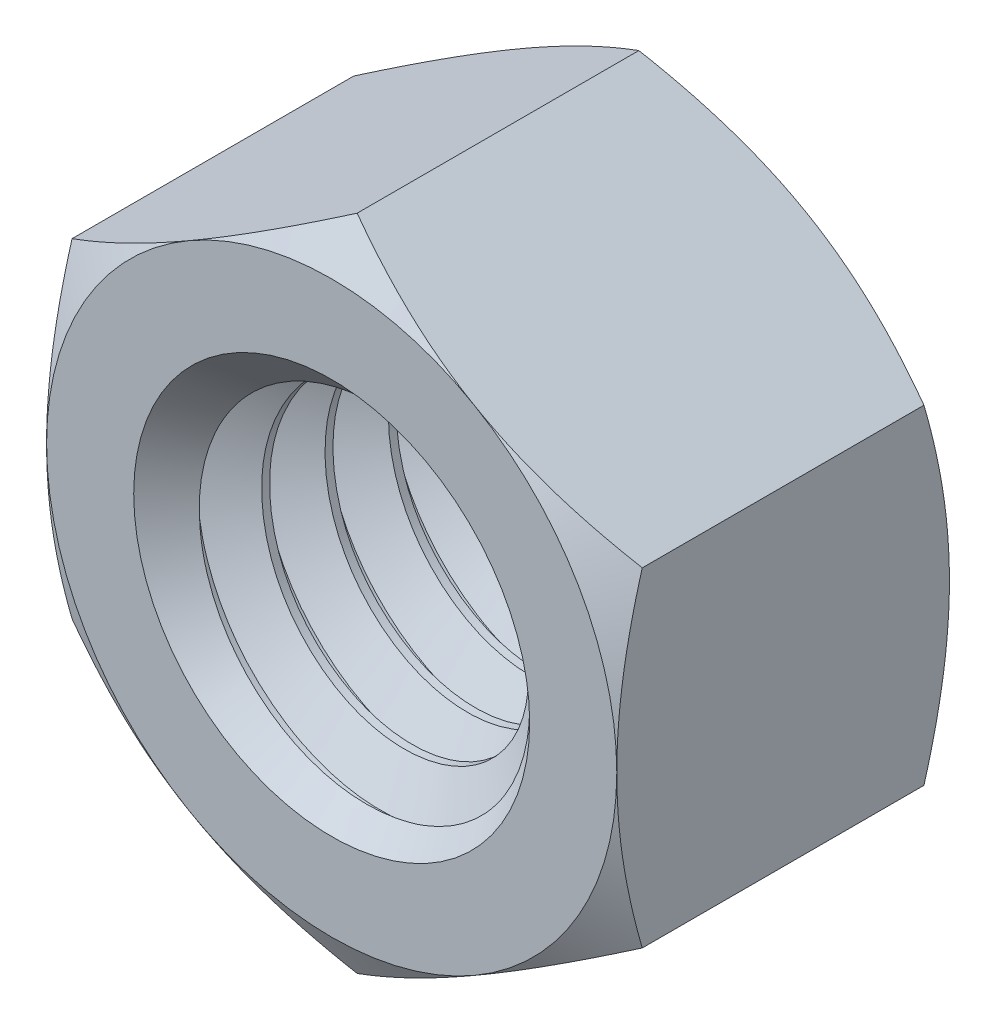
from build123d import *

# Parameters (mm, degrees)
SKETCH4_R                 = 4.7625
BOSS_EXTRUDE2_DEPTH       = 4.1671875
SKETCH5_OUTSIDE_W         = 71.99
SKETCH5_OUTSIDE_H         = 74.2
SKETCH5_OUTSIDE_R         = 7.14375
CUT_EXTRUDE1_DEPTH        = 14.730957339
CUT_EXTRUDE1_DRAFT        = -60
MIRROR1_COPY_1_SKETCH_W   = 71.99
MIRROR1_COPY_1_SKETCH_H   = 74.2
MIRROR1_COPY_1_SKETCH_R   = 7.14375
MIRROR1_COPY_1_DEPTH      = 14.730957339
MIRROR1_COPY_1_DRAFT      = -60
SKETCH6_R                 = 4.7625
BOSS_EXTRUDE3_DEPTH       = 8.334375
BODY_MOVE_COPY1_START     = -4.1671875
BODY_MOVE_COPY1_OUTLINE_R = 4.7625
BODY_MOVE_COPY1_DEPTH     = 8.334375
CUT_SWEEP1_PITCH          = 1.5875


# Read off the part's stored shape, not the designer's step: Body-Move/Copy1
with BuildPart() as part:
    # Sketch4 → Boss-Extrude2 (new, symmetric)
    with BuildSketch(Plane.XY):
        Polygon((0, 8.248891971), (-7.14375, 4.124445986), (-7.14375, -4.124445986), (0, -8.248891971), (7.14375, -4.124445986), (7.14375, 4.124445986), align=None)
        Circle(SKETCH4_R, mode=Mode.SUBTRACT)
    extrude(amount=BOSS_EXTRUDE2_DEPTH, both=True)


with BuildPart() as cut_extrude1_tool:
    # Sketch5 outside → Cut-Extrude1 (with draft: the straight prism first)
    with BuildSketch(Plane.XY.offset(4.1671875)):
        Rectangle(SKETCH5_OUTSIDE_W, SKETCH5_OUTSIDE_H)
        Circle(SKETCH5_OUTSIDE_R, mode=Mode.SUBTRACT)
    extrude(amount=-CUT_EXTRUDE1_DEPTH)
    # Cut-Extrude1: the draft: its side faces are tilted about the plane it starts from
    cut_extrude1_sides = [cut_extrude1_tool.faces().sort_by_distance(p)[0] for p in [
        (0, -37.1, -3.19829117),
        (35.995, 0, -3.19829117),
        (0, 37.1, -3.19829117),
        (-35.995, 0, -3.19829117),
        (-7.14375, 0, -3.19829117),
    ]]
    draft(cut_extrude1_sides, Plane.XY.offset(4.1671875), CUT_EXTRUDE1_DRAFT)


with BuildPart() as part_1:
    add(part.part)

    # Cut-Extrude1: cut by cut_extrude1_tool
    add(cut_extrude1_tool.part, mode=Mode.SUBTRACT)


with BuildPart() as mirror1_copy_1_tool:
    # Mirror1 copy 1 sketch → Mirror1 copy 1 (with draft: the straight prism first)
    with BuildSketch(Plane(origin=(0, 0, -4.1671875), x_dir=(1, 0, 0), z_dir=(0, 0, -1))):
        Rectangle(MIRROR1_COPY_1_SKETCH_W, MIRROR1_COPY_1_SKETCH_H)
        Circle(MIRROR1_COPY_1_SKETCH_R, mode=Mode.SUBTRACT)
    extrude(amount=-MIRROR1_COPY_1_DEPTH)
    # Mirror1 copy 1: the draft: its side faces are tilted about the plane it starts from
    mirror1_copy_1_sides = [mirror1_copy_1_tool.faces().sort_by_distance(p)[0] for p in [
        (0, -37.1, 3.19829117),
        (35.995, 0, 3.19829117),
        (0, 37.1, 3.19829117),
        (-35.995, 0, 3.19829117),
        (-7.14375, 0, 3.19829117),
    ]]
    draft(mirror1_copy_1_sides, Plane(origin=(0, 0, -4.1671875), x_dir=(1, 0, 0), z_dir=(0, 0, -1)), MIRROR1_COPY_1_DRAFT)


with BuildPart() as part_2:
    add(part_1.part)

    # Mirror1 copy 1: cut by mirror1_copy_1_tool
    add(mirror1_copy_1_tool.part, mode=Mode.SUBTRACT)


with BuildPart() as body_2:
    # Sketch6 → Boss-Extrude3 (new body)
    with BuildSketch(Plane.XY.offset(4.1671875)):
        Circle(SKETCH6_R)
    extrude(amount=-BOSS_EXTRUDE3_DEPTH)

    # Cut-Sweep1: the profile of Sketch8 screwed along a right-hand helix of 6.25 turns, 8 arcs to a turn; built about Z, then put on its axis
    cut_sweep1_z = Axis((0, 0, 0), (0, 0, 1))
    cut_sweep1_corners = [(4.934351916, 0, -1.48828125), (4.848425958, 0, 0.049609375), (3.731388504, 0, -0.5953125), (3.731388504, 0, -0.79375)]
    with BuildLine(mode=Mode.PRIVATE) as cut_sweep1_profile:
        Line(cut_sweep1_corners[0], cut_sweep1_corners[1])
        Line(cut_sweep1_corners[1], cut_sweep1_corners[2])
        Line(cut_sweep1_corners[2], cut_sweep1_corners[3])
        Line(cut_sweep1_corners[3], cut_sweep1_corners[0])
    cut_sweep1_cap = Face(cut_sweep1_profile.wire())
    cut_sweep1_turn_angles = [0, 22.5, 45, 67.5, 90, 112.5, 135, 157.5, 180, 202.5, 225, 247.5, 270, 292.5, 315, 337.5, 360]
    cut_sweep1_turn_weights = [1, 0.9238795325112867, 1, 0.9238795325112867, 1, 0.9238795325112867, 1, 0.9238795325112867, 1, 0.9238795325112867, 1, 0.9238795325112867, 1, 0.9238795325112867, 1, 0.9238795325112867, 1]
    cut_sweep1_turn_rails = [Edge.make_bspline([Vector(p[0], p[1], 0).rotate(cut_sweep1_z, cut_sweep1_turn_angles[k]) / cut_sweep1_turn_weights[k] + Vector(0, 0, p[2] + CUT_SWEEP1_PITCH * cut_sweep1_turn_angles[k] / 360) for k in range(17)], [0, 0, 0, 1, 1, 2, 2, 3, 3, 4, 4, 5, 5, 6, 6, 7, 7, 8, 8, 8], 2, cut_sweep1_turn_weights) for p in cut_sweep1_corners]
    cut_sweep1_turn_sides = [Face.make_surface_from_curves(cut_sweep1_turn_rails[p[0]], cut_sweep1_turn_rails[p[1]]) for p in [(0, 1), (1, 2), (2, 3), (3, 0)]]
    cut_sweep1_last_angles = [2160, 2182.5, 2205, 2227.5, 2250]
    cut_sweep1_last_weights = [1, 0.9238795325112867, 1, 0.9238795325112776, 1]
    cut_sweep1_last_rails = [Edge.make_bspline([Vector(p[0], p[1], 0).rotate(cut_sweep1_z, cut_sweep1_last_angles[k]) / cut_sweep1_last_weights[k] + Vector(0, 0, p[2] + CUT_SWEEP1_PITCH * cut_sweep1_last_angles[k] / 360) for k in range(5)], [0, 0, 0, 1, 1, 2, 2, 2], 2, cut_sweep1_last_weights) for p in cut_sweep1_corners]
    cut_sweep1_last_sides = [Face.make_surface_from_curves(cut_sweep1_last_rails[p[0]], cut_sweep1_last_rails[p[1]]) for p in [(0, 1), (1, 2), (2, 3), (3, 0)]]
    cut_sweep1 = Plane(origin=(0, 0, 4.1671875), x_dir=(0, 1, 0), z_dir=(0, 0, -1)) * Solid(Shell([*[p.moved(Location((0, 0, CUT_SWEEP1_PITCH * i))) for i in range(6) for p in cut_sweep1_turn_sides], *cut_sweep1_last_sides, cut_sweep1_cap, cut_sweep1_cap.rotate(cut_sweep1_z, 2250).moved(Location((0, 0, CUT_SWEEP1_PITCH * 2250 / 360)))]))
    add(cut_sweep1, mode=Mode.SUBTRACT)


with BuildPart() as body_3:
    # Body-Move/Copy1 outline → Body-Move/Copy1 (new body)
    with BuildSketch(Plane.XY.offset(BODY_MOVE_COPY1_START)):
        Circle(BODY_MOVE_COPY1_OUTLINE_R)
    extrude(amount=BODY_MOVE_COPY1_DEPTH)


with BuildPart() as part_3:
    add(part_2.part)

    # Combine1: union body 3
    add(body_3.part)

    # Combine2: cut body 2
    add(body_2.part, mode=Mode.SUBTRACT)

    # Cut-Extrude2 cone 1 section (through the dimple's axis) → Cut-Extrude2 (revolve, cut)
    with BuildSketch(Plane(origin=(0, 0, 4.1671875), x_dir=(0, -1, 0), z_dir=(1, 0, 0))):
        Polygon((0, 0), (4.9609375, 0), (0, 4.9609375), align=None)
    cut_extrude2 = revolve(axis=Axis((0, 0, 4.1671875), (0, 0, -1)), mode=Mode.SUBTRACT)

    # Mirror2: Cut-Extrude2 across plane
    add(cut_extrude2.mirror(Plane.XY), mode=Mode.SUBTRACT)


solid = part_3.part
